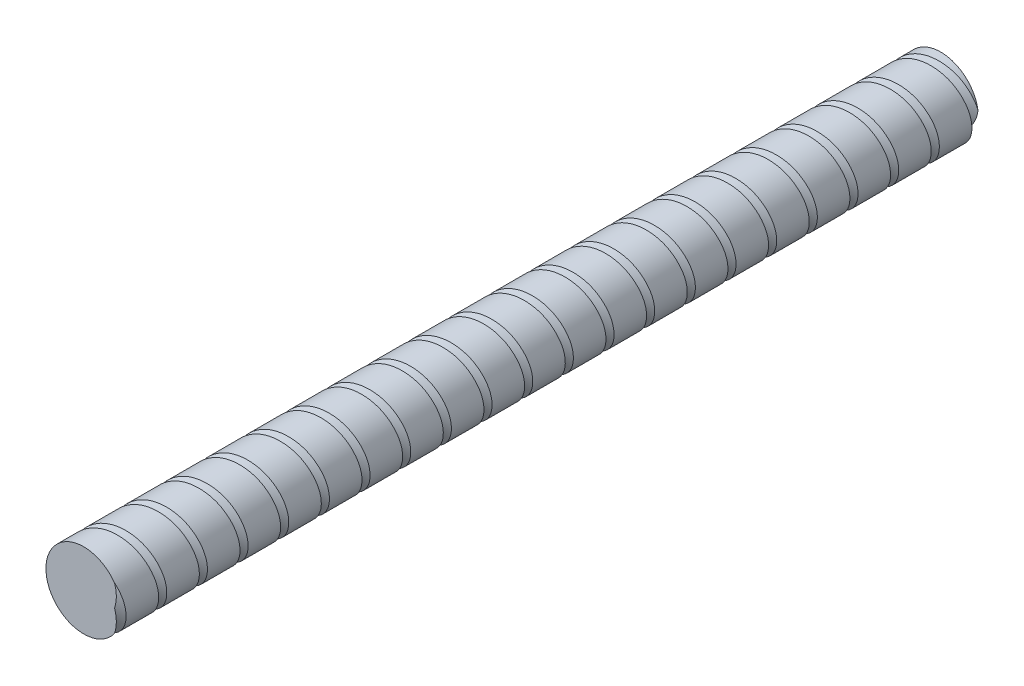
from build123d import *

# Parameters (mm, degrees)
SKETCH_1_R      = 6
EXTRUDE_1_DEPTH = 68.02
SWEEP_2_PITCH   = 6.455


with BuildPart() as part:
    # 草图1 → 凸台-拉伸1 (new, symmetric)
    with BuildSketch(Plane.XY):
        Circle(SKETCH_1_R)
    extrude(amount=EXTRUDE_1_DEPTH, both=True)

    # 切除-扫描2: arcs per turn and ends read off the stored shape
    # 切除-扫描2: the profile of 草图3 screwed along a right-hand helix through 101 turns, 8 arcs to a turn; built about Z, then put on its axis
    sweep_2_z = Axis((0, 0, 0), (0, 0, 1))
    sweep_2_corners = [(6.011543831, 0, -5.805), (6.011543831, 0, -7.105), (4.885710806, 0, -6.455)]
    with BuildLine(mode=Mode.PRIVATE) as sweep_2_profile:
        Line(sweep_2_corners[0], sweep_2_corners[1])
        Line(sweep_2_corners[1], sweep_2_corners[2])
        Line(sweep_2_corners[2], sweep_2_corners[0])
    sweep_2_cap = Face(sweep_2_profile.wire())
    sweep_2_turn_angles = [0, 22.5, 45, 67.5, 90, 112.5, 135, 157.5, 180, 202.5, 225, 247.5, 270, 292.5, 315, 337.5, 360]
    sweep_2_turn_weights = [1, 0.9238795325112867, 1, 0.9238795325112867, 1, 0.9238795325112867, 1, 0.9238795325112867, 1, 0.9238795325112867, 1, 0.9238795325112867, 1, 0.9238795325112867, 1, 0.9238795325112867, 1]
    sweep_2_turn_rails = [Edge.make_bspline([Vector(p[0], p[1], 0).rotate(sweep_2_z, sweep_2_turn_angles[k]) / sweep_2_turn_weights[k] + Vector(0, 0, p[2] + SWEEP_2_PITCH * sweep_2_turn_angles[k] / 360) for k in range(17)], [0, 0, 0, 1, 1, 2, 2, 3, 3, 4, 4, 5, 5, 6, 6, 7, 7, 8, 8, 8], 2, sweep_2_turn_weights) for p in sweep_2_corners]
    sweep_2_turn_sides = [Face.make_surface_from_curves(sweep_2_turn_rails[p[0]], sweep_2_turn_rails[p[1]]) for p in [(0, 1), (1, 2), (2, 0)]]
    sweep_2 = Plane(origin=(0, 0, 68.02), x_dir=(1, 0, 0), z_dir=(0, 0, -1)) * Solid(Shell([*[p.moved(Location((0, 0, SWEEP_2_PITCH * i))) for i in range(101) for p in sweep_2_turn_sides], sweep_2_cap, sweep_2_cap.rotate(sweep_2_z, 36360).moved(Location((0, 0, SWEEP_2_PITCH * 36360 / 360)))]))
    add(sweep_2, mode=Mode.SUBTRACT)


solid = part.part
